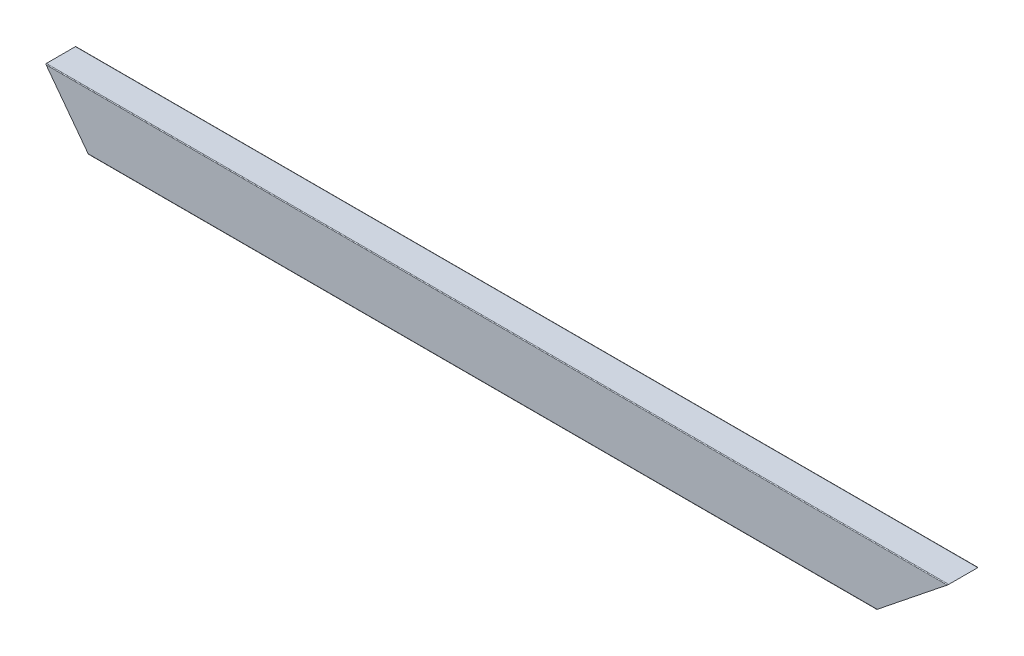
from build123d import *

# Parameters (mm, degrees)
BOSS_EXTRUDE1_DEPTH      = 13.49375
BOSS_EXTRUDE1_DEPTH_BACK = 13.49375
CUT_EXTRUDE1_DEPTH       = 414.750895817
CUT_EXTRUDE1_DEPTH_BACK  = 414.750895817
SKETCH3_W                = 23.6140625
SKETCH3_H                = 47.228125
FILLET1_R                = 1.27
FILLET2_R                = 0.635


with BuildPart() as part:
    # Sketch2 → Boss-Extrude1 (new, two sides: drawn at the far end of the back side and taken through both)
    with BuildSketch(Plane.XY.offset(-BOSS_EXTRUDE1_DEPTH_BACK)):
        Polygon((-349.25, -25.4), (-387.383370876, 25.4), (-349.25, 25.4), (349.25, 25.4), (412.75, 25.4), (349.25, -25.4), align=None)
    extrude(amount=BOSS_EXTRUDE1_DEPTH + BOSS_EXTRUDE1_DEPTH_BACK)

    # Sketch3 → Cut-Extrude1 (cut, two sides: drawn at the far end of the back side and taken through both)
    with BuildSketch(Plane(origin=(0, 0, 0), x_dir=(0, 0, -1), z_dir=(1, 0, 0)).offset(-CUT_EXTRUDE1_DEPTH_BACK)):
        Rectangle(SKETCH3_W, SKETCH3_H)
    extrude(amount=CUT_EXTRUDE1_DEPTH + CUT_EXTRUDE1_DEPTH_BACK, mode=Mode.SUBTRACT)

    # Fillet1
    fillet1_edges = [part.edges().sort_by_distance(p)[0] for p in [
        (0.445897778, -23.6140625, -11.80703125),
        (0.445897778, -23.6140625, 11.80703125),
        (12.237416785, 23.6140625, 11.80703125),
        (12.237416785, 23.6140625, -11.80703125),
    ]]
    fillet(fillet1_edges, radius=FILLET1_R)

    # Fillet2
    fillet2_edges = [part.edges().sort_by_distance(p)[0] for p in [
        (0, -25.4, 13.49375),
        (0, -25.4, -13.49375),
        (12.683314562, 25.4, -13.49375),
        (12.683314562, 25.4, 13.49375),
    ]]
    fillet(fillet2_edges, radius=FILLET2_R)


solid = part.part
